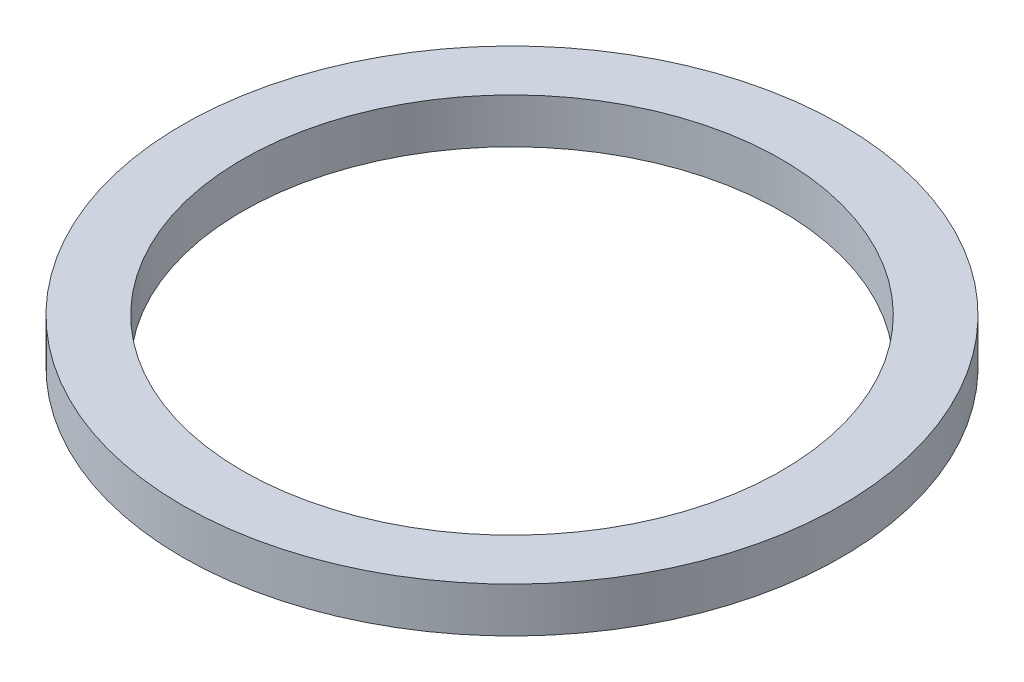
from build123d import *

# Parameters (mm, degrees)
SKETCH1_R           = 11000
SKETCH1_R_2         = 9000
BOSS_EXTRUDE1_DEPTH = 1500


with BuildPart() as part:
    # Sketch1 → Boss-Extrude1 (new body)
    with BuildSketch(Plane(origin=(0, 0, 0), x_dir=(1, 0, 0), z_dir=(0, 1, 0))):
        Circle(SKETCH1_R)
        Circle(SKETCH1_R_2, mode=Mode.SUBTRACT)
    extrude(amount=BOSS_EXTRUDE1_DEPTH)


solid = part.part
